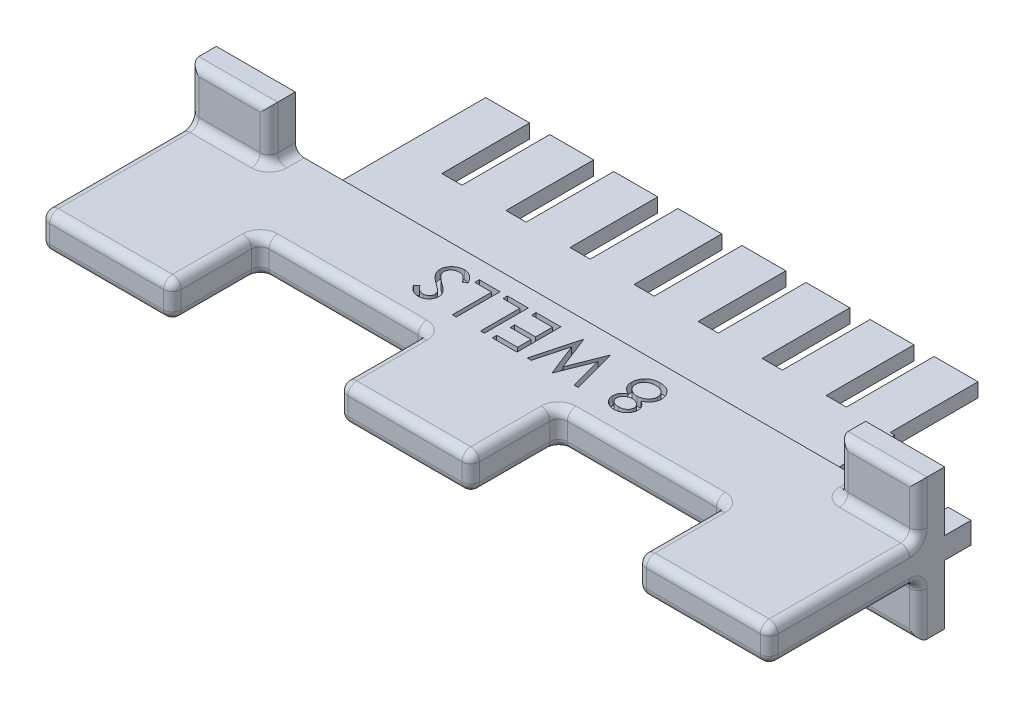
from build123d import *

# Parameters (mm, degrees)
SKETCH1_W           = 83
SKETCH1_H           = 4
BOSS_EXTRUDE1_DEPTH = 10
SKETCH2_W           = 15
SKETCH2_H           = 4
BOSS_EXTRUDE2_DEPTH = 10
SKETCH3_W           = 2.6
SKETCH3_H           = 2.45
BOSS_EXTRUDE3_DEPTH = 3
SKETCH4_W           = 56.6
SKETCH4_H           = 1.6
BOSS_EXTRUDE4_DEPTH = 7.5
SKETCH5_W           = 5
SKETCH5_H           = 1.6
BOSS_EXTRUDE5_DEPTH = 10
SKETCH6_W           = 9
SKETCH6_H           = 6
BOSS_EXTRUDE6_DEPTH = 3
FILLET1_R           = 1
CUT_EXTRUDE1_DEPTH  = 1


with BuildPart() as part:
    # Sketch1 → Boss-Extrude1 (new body)
    with BuildSketch(Plane.XY):
        Rectangle(SKETCH1_W, SKETCH1_H)
    extrude(amount=BOSS_EXTRUDE1_DEPTH)

    # Sketch2 → Boss-Extrude2 (add)
    with BuildSketch(Plane.XY.offset(10)):
        with Locations((-34, 0)):
            Rectangle(SKETCH2_W, SKETCH2_H)
        with Locations((34, 0)):
            Rectangle(SKETCH2_W, SKETCH2_H)
        Rectangle(SKETCH2_W, SKETCH2_H)
    extrude(amount=BOSS_EXTRUDE2_DEPTH)

    # Sketch3 → Boss-Extrude3 (add)
    with BuildSketch(Plane(origin=(0, 0, 0), x_dir=(-1, 0, 0), z_dir=(0, 0, -1))):
        with Locations((40.2, 0)):
            Rectangle(SKETCH3_W, SKETCH3_H)
        with Locations((-40.2, 0)):
            Rectangle(SKETCH3_W, SKETCH3_H)
    extrude(amount=BOSS_EXTRUDE3_DEPTH)

    # Sketch4 → Boss-Extrude4 (add)
    with BuildSketch(Plane(origin=(0, 0, 0), x_dir=(-1, 0, 0), z_dir=(0, 0, -1))):
        Rectangle(SKETCH4_W, SKETCH4_H)
    extrude(amount=BOSS_EXTRUDE4_DEPTH)

    # Sketch5 → Boss-Extrude5 (add)
    with BuildSketch(Plane(origin=(0, 0, -7.5), x_dir=(-1, 0, 0), z_dir=(0, 0, -1))):
        with Locations((25.8, 0)):
            Rectangle(SKETCH5_W, SKETCH5_H)
        with Locations((18.500007934, 0)):
            Rectangle(SKETCH5_W, SKETCH5_H)
        with Locations((11.200015868, 0)):
            Rectangle(SKETCH5_W, SKETCH5_H)
        with Locations((3.900023803, 0)):
            Rectangle(SKETCH5_W, SKETCH5_H)
        with Locations((-3.399968263, 0)):
            Rectangle(SKETCH5_W, SKETCH5_H)
        with Locations((-10.699960329, 0)):
            Rectangle(SKETCH5_W, SKETCH5_H)
        with Locations((-17.999952395, 0)):
            Rectangle(SKETCH5_W, SKETCH5_H)
        with Locations((-25.299944461, 0)):
            Rectangle(SKETCH5_W, SKETCH5_H)
    extrude(amount=BOSS_EXTRUDE5_DEPTH)

    # Sketch6 → Boss-Extrude6 (add)
    with BuildSketch(Plane(origin=(0, 0, 0), x_dir=(-1, 0, 0), z_dir=(0, 0, -1))):
        with Locations((37, -5)):
            Rectangle(SKETCH6_W, SKETCH6_H)
        with Locations((37, 5)):
            Rectangle(SKETCH6_W, SKETCH6_H)
        with Locations((-37, -5)):
            Rectangle(SKETCH6_W, SKETCH6_H)
        with Locations((-37, 5)):
            Rectangle(SKETCH6_W, SKETCH6_H)
    extrude(amount=-BOSS_EXTRUDE6_DEPTH)

    # Fillet1
    fillet1_edges = [part.edges().sort_by_distance(p)[0] for p in [
        (-41.5, -2, 11.5),
        (-32.5, -2, 1.5),
        (-37, -2, 3),
        (-32.5, -5, 3),
        (-37, -8, 3),
        (-41.5, -5, 3),
        (-26.5, 0, 20),
        (-34, -2, 20),
        (-41.5, 0, 20),
        (-34, 2, 20),
        (32.5, -2, 1.5),
        (41.5, -2, 11.5),
        (41.5, 2, 11.5),
        (32.5, 2, 1.5),
        (-32.5, 2, 1.5),
        (-41.5, 2, 11.5),
        (37, -8, 3),
        (32.5, -5, 3),
        (37, -2, 3),
        (41.5, -5, 3),
        (34, -2, 20),
        (26.5, 0, 20),
        (34, 2, 20),
        (41.5, 0, 20),
        (37, 2, 3),
        (32.5, 5, 3),
        (37, 8, 3),
        (41.5, 5, 3),
        (0, -2, 20),
        (-7.5, 0, 20),
        (0, 2, 20),
        (7.5, 0, 20),
        (-37, 8, 3),
        (-32.5, 5, 3),
        (-37, 2, 3),
        (-41.5, 5, 3),
        (26.5, 2, 15),
        (26.5, -2, 15),
        (26.5, 0, 10),
        (17, -2, 10),
        (17, 2, 10),
        (7.5, -2, 15),
        (7.5, 2, 15),
        (7.5, 0, 10),
        (-7.5, 2, 15),
        (-7.5, -2, 15),
        (-26.5, -2, 15),
        (-26.5, 2, 15),
        (-26.5, 0, 10),
        (-17, 2, 10),
        (-7.5, 0, 10),
        (-17, -2, 10),
    ]]
    fillet(fillet1_edges, radius=FILLET1_R)

    # Sketch8 → Cut-Extrude1 (cut)
    # profile 1 of 6: a face of its own
    with BuildSketch(Plane(origin=(0, 2, 0), x_dir=(1, 0, 0), z_dir=(0, 1, 0))):
        with BuildLine():
            add(Edge.make_bspline(
                [(10.261418269, -4.830480864), (10.220817543, -4.809144786), (10.141384874, -4.767402142), (10.028230031, -4.69998647), (9.922617945, -4.63139338), (9.826501979, -4.559156677), (9.738939811, -4.48481186), (9.659661979, -4.408555649), (9.5878159, -4.330629215), (9.525869801, -4.249029215), (9.470907682, -4.165206737), (9.424348025, -4.07812869), (9.383713268, -3.989053365), (9.351820047, -3.896628417), (9.325488539, -3.802121786), (9.307384504, -3.704265351), (9.297644979, -3.603716879), (9.295803964, -3.535762082), (9.294871795, -3.501354261)],
                knots=[0, 0, 0, 0, 1.264219729, 2.473363326, 3.62979159, 4.734286947, 5.785533755, 6.79450939, 7.765315851, 8.704182021, 9.615576613, 10.525715488, 11.423813905, 12.311666436, 13.218214638, 14.126256791, 15.051260205, 16, 16, 16, 16], degree=3))
            add(Edge.make_bspline(
                [(9.294871795, -3.501354261), (9.295967647, -3.453212569), (9.298136751, -3.357922096), (9.317226531, -3.217314953), (9.345424662, -3.080203895), (9.388260323, -2.948143234), (9.440971639, -2.820007788), (9.507486351, -2.697523887), (9.582556815, -2.577175581), (9.642929245, -2.503152652), (9.673477564, -2.46569721)],
                knots=[0, 0, 0, 0, 1.02531512, 2.029483338, 3.018748588, 4.004195107, 4.983200899, 5.966616707, 6.971112471, 8, 8, 8, 8], degree=3))
            add(Edge.make_bspline(
                [(9.673477564, -2.46569721), (9.713243956, -2.421991818), (9.792285335, -2.335121115), (9.927689518, -2.222334243), (10.076292209, -2.127549395), (10.237518398, -2.050303831), (10.410937115, -1.990181175), (10.596511407, -1.946977578), (10.794603054, -1.922231251), (10.930753727, -1.918654123), (11.000600962, -1.916819005)],
                knots=[0, 0, 0, 0, 0.954267603, 1.896743057, 2.838368354, 3.796610408, 4.779680527, 5.799409237, 6.871065594, 8, 8, 8, 8], degree=3))
            add(Edge.make_bspline(
                [(11.000600962, -1.916819005), (11.067761399, -1.91846982), (11.198448787, -1.921682139), (11.388695621, -1.943327642), (11.566250852, -1.981648457), (11.731956309, -2.033013758), (11.88420967, -2.101510608), (12.023287764, -2.185467751), (12.151229032, -2.28298971), (12.264019798, -2.39642346), (12.364127822, -2.517945612), (12.452142418, -2.64327754), (12.524886205, -2.772328026), (12.587585506, -2.903134075), (12.634245953, -3.038346099), (12.667340624, -3.176576511), (12.688128694, -3.317432615), (12.690908994, -3.412475114), (12.692307692, -3.460288556)],
                knots=[0, 0, 0, 0, 1.256864279, 2.445730223, 3.576845088, 4.651810441, 5.686528262, 6.692706664, 7.686234615, 8.689148594, 9.678739427, 10.630299996, 11.55097961, 12.448208961, 13.341360817, 14.221834469, 15.105450545, 16, 16, 16, 16], degree=3))
            add(Edge.make_bspline(
                [(12.692307692, -3.460288556), (12.691481946, -3.495373037), (12.689849979, -3.564712356), (12.678560262, -3.667155395), (12.660394486, -3.766859928), (12.635778189, -3.864219498), (12.602111102, -3.958720389), (12.562169928, -4.050849955), (12.515149581, -4.140605528), (12.459198526, -4.2266206), (12.39755497, -4.311942035), (12.324378397, -4.392333231), (12.24454745, -4.472516255), (12.153309764, -4.547615184), (12.055592846, -4.623834244), (11.94683941, -4.694802869), (11.830675736, -4.766059818), (11.748092628, -4.80863874), (11.705729167, -4.830480864)],
                knots=[0, 0, 0, 0, 0.941575622, 1.860885767, 2.762557628, 3.660168386, 4.552890429, 5.45184204, 6.353736508, 7.268493418, 8.204037487, 9.175167802, 10.182660057, 11.238220596, 12.344046335, 13.507168087, 14.721227736, 16, 16, 16, 16], degree=3))
            add(Edge.make_bspline(
                [(11.705729167, -4.830480864), (11.763646249, -4.862193809), (11.875614569, -4.923502927), (12.025289116, -5.034739717), (12.152076113, -5.157398979), (12.254628155, -5.2916653), (12.335598184, -5.433125812), (12.392844918, -5.581035802), (12.430211169, -5.73374558), (12.433996405, -5.83787849), (12.435897436, -5.890176377)],
                knots=[0, 0, 0, 0, 1.16701039, 2.256125286, 3.287752239, 4.277689688, 5.235169525, 6.160862735, 7.076343936, 8, 8, 8, 8], degree=3))
            add(Edge.make_bspline(
                [(12.435897436, -5.890176377), (12.433556971, -5.943456144), (12.42885223, -6.050557769), (12.390939866, -6.210032944), (12.328689763, -6.366748966), (12.245470643, -6.520342668), (12.139564028, -6.66381539), (12.014208748, -6.793535387), (11.869562489, -6.906145363), (11.708804528, -7.001337807), (11.536115572, -7.079184233), (11.35360603, -7.132328819), (11.16452867, -7.167282059), (11.035815236, -7.17122835), (10.970552885, -7.173229261)],
                knots=[0, 0, 0, 0, 0.888724595, 1.786491426, 2.720083884, 3.697804067, 4.69440576, 5.687697823, 6.7000873, 7.744853364, 8.800284131, 9.853047784, 10.91141782, 12, 12, 12, 12], degree=3))
            add(Edge.make_bspline(
                [(10.970552885, -7.173229261), (10.906973633, -7.171171984), (10.781602593, -7.167115268), (10.597044831, -7.132946984), (10.420306525, -7.076520153), (10.252378227, -6.999666605), (10.096833088, -6.903904835), (9.958412313, -6.790055598), (9.835985899, -6.661749053), (9.734839584, -6.517803128), (9.653698873, -6.364219668), (9.595268216, -6.204902917), (9.558327878, -6.041762837), (9.553633861, -5.931432127), (9.551282051, -5.876153941)],
                knots=[0, 0, 0, 0, 1.072634126, 2.115112298, 3.156050586, 4.19761425, 5.225177188, 6.230426315, 7.215180151, 8.209739481, 9.190420596, 10.139012357, 11.067603024, 12, 12, 12, 12], degree=3))
            add(Edge.make_bspline(
                [(9.551282051, -5.876153941), (9.553343821, -5.821906327), (9.55739302, -5.715367095), (9.591006984, -5.560281358), (9.648497298, -5.415341124), (9.726051913, -5.278316081), (9.827844113, -5.151395878), (9.951818618, -5.033950186), (10.096366716, -4.923682014), (10.205171279, -4.86224236), (10.261418269, -4.830480864)],
                knots=[0, 0, 0, 0, 0.975463758, 1.915755378, 2.838359076, 3.772025586, 4.738400888, 5.753889765, 6.838863581, 8, 8, 8, 8], degree=3))
        make_face()
        with BuildLine():
            add(Edge.make_bspline(
                [(10.995592949, -6.660408749), (11.030666754, -6.659481132), (11.099286454, -6.657666308), (11.199881673, -6.648111771), (11.295618254, -6.629759005), (11.387019721, -6.604615962), (11.474399182, -6.573332979), (11.555752868, -6.532116582), (11.633814728, -6.486304386), (11.706023871, -6.432568766), (11.77139148, -6.373942043), (11.829776279, -6.312715664), (11.87734177, -6.247084704), (11.918264106, -6.180332593), (11.948654656, -6.109690619), (11.970243055, -6.036705512), (11.985521333, -5.960914987), (11.986622473, -5.909283195), (11.987179487, -5.883165159)],
                knots=[0, 0, 0, 0, 1.20353747, 2.354645537, 3.462130888, 4.543058862, 5.604822423, 6.639552563, 7.666902586, 8.706944258, 9.720926464, 10.677177239, 11.602682187, 12.496457588, 13.358248655, 14.231532794, 15.105417644, 16, 16, 16, 16], degree=3))
            add(Edge.make_bspline(
                [(11.987179487, -5.883165159), (11.986163624, -5.857061911), (11.984156131, -5.805478144), (11.969625835, -5.72899801), (11.945331058, -5.654819648), (11.912017693, -5.582250585), (11.869266227, -5.511477091), (11.817378713, -5.442227966), (11.754103767, -5.376334447), (11.684229132, -5.31192701), (11.607903457, -5.252587485), (11.527699058, -5.199582173), (11.443030597, -5.157326806), (11.356433697, -5.120277484), (11.266077039, -5.092486196), (11.172583639, -5.072464211), (11.076053367, -5.060079364), (11.010653647, -5.058595447), (10.977564103, -5.057844646)],
                knots=[0, 0, 0, 0, 0.873213166, 1.72559466, 2.594724523, 3.479581045, 4.391597569, 5.35687048, 6.368548091, 7.443976143, 8.534559525, 9.600545123, 10.654815915, 11.696401765, 12.749428718, 13.812189468, 14.893058657, 16, 16, 16, 16], degree=3))
            add(Edge.make_bspline(
                [(10.977564103, -5.057844646), (10.93506141, -5.059085311), (10.85047582, -5.061554387), (10.725828689, -5.084720478), (10.604326533, -5.120699608), (10.488268382, -5.17176548), (10.379731404, -5.234027049), (10.281776788, -5.307450863), (10.198503754, -5.393761224), (10.127659594, -5.487951478), (10.07226949, -5.587864582), (10.029839803, -5.688540198), (10.004852462, -5.790807584), (10.001604313, -5.859334595), (10, -5.893181185)],
                knots=[0, 0, 0, 0, 1.076561449, 2.142489767, 3.202892658, 4.283174188, 5.348766409, 6.369549039, 7.375093932, 8.378927502, 9.349008457, 10.26378795, 11.142457041, 12, 12, 12, 12], degree=3))
            add(Edge.make_bspline(
                [(10, -5.893181185), (10.000745799, -5.916940503), (10.002226104, -5.964099345), (10.01491883, -6.033968273), (10.034715608, -6.102291267), (10.063572208, -6.16866724), (10.098479712, -6.234638165), (10.142975441, -6.298134474), (10.194543451, -6.361077743), (10.253928202, -6.421396161), (10.321020722, -6.478024711), (10.396363738, -6.527112793), (10.479292373, -6.568046793), (10.568694837, -6.602436411), (10.665515923, -6.627977869), (10.768922023, -6.647198743), (10.879846176, -6.658010014), (10.95617389, -6.659591829), (10.995592949, -6.660408749)],
                knots=[0, 0, 0, 0, 0.814035228, 1.61574325, 2.427118093, 3.24780647, 4.092880925, 4.981933388, 5.900917883, 6.880367106, 7.87994501, 8.905470125, 9.95492938, 11.0455354, 12.184050453, 13.382997595, 14.64846247, 16, 16, 16, 16], degree=3))
        make_face(mode=Mode.SUBTRACT)
        with BuildLine():
            add(Edge.make_bspline(
                [(10.966546474, -4.545024133), (11.01101176, -4.544232991), (11.098241802, -4.542680963), (11.22603914, -4.525413446), (11.348680234, -4.501359815), (11.4657886, -4.464929314), (11.576763103, -4.417528281), (11.683165506, -4.361318776), (11.783329578, -4.293946131), (11.876807618, -4.217044059), (11.962389274, -4.133707132), (12.037745118, -4.045692204), (12.101410122, -3.95419441), (12.153074987, -3.859098018), (12.193155221, -3.760612554), (12.222735053, -3.658680546), (12.239909065, -3.553017669), (12.24235601, -3.481382498), (12.243589744, -3.445264518)],
                knots=[0, 0, 0, 0, 1.140332253, 2.237053636, 3.304055028, 4.344690294, 5.377465719, 6.397042765, 7.428360044, 8.469453732, 9.499453352, 10.490108612, 11.438398528, 12.354680514, 13.261581007, 14.161901135, 15.073242693, 16, 16, 16, 16], degree=3))
            add(Edge.make_bspline(
                [(12.243589744, -3.445264518), (12.241606243, -3.400371068), (12.237656619, -3.310977491), (12.207446646, -3.179195487), (12.157833138, -3.051653911), (12.088231235, -2.930151539), (12.003333187, -2.816161533), (11.900123049, -2.715401577), (11.781117194, -2.629228053), (11.647293311, -2.557204666), (11.500596132, -2.500161167), (11.34193222, -2.459350436), (11.172376311, -2.433699167), (11.055449376, -2.431014059), (10.995592949, -2.429639518)],
                knots=[0, 0, 0, 0, 0.899105568, 1.790333855, 2.694925079, 3.632758987, 4.588257081, 5.534574046, 6.511571685, 7.523527334, 8.572244311, 9.657983075, 10.801090915, 12, 12, 12, 12], degree=3))
            add(Edge.make_bspline(
                [(10.995592949, -2.429639518), (10.948809952, -2.430548306), (10.857661673, -2.432318918), (10.72463683, -2.447622631), (10.599397239, -2.47262089), (10.480743066, -2.506515849), (10.36955748, -2.551446588), (10.265992032, -2.607254872), (10.168636442, -2.670999996), (10.081651501, -2.746468708), (10.002560804, -2.827224899), (9.933283588, -2.912263838), (9.874653758, -3.000733852), (9.827392483, -3.092583157), (9.789862517, -3.187474211), (9.762807684, -3.285796544), (9.746133027, -3.387936356), (9.744445262, -3.45722023), (9.743589744, -3.492339838)],
                knots=[0, 0, 0, 0, 1.224631902, 2.385975653, 3.500340538, 4.565441647, 5.612488581, 6.63322211, 7.641830068, 8.652595074, 9.641693811, 10.598750962, 11.520088299, 12.415429315, 13.298523938, 14.187139574, 15.081071174, 16, 16, 16, 16], degree=3))
            add(Edge.make_bspline(
                [(9.743589744, -3.492339838), (9.744875263, -3.526454209), (9.747410084, -3.593721789), (9.763729353, -3.693331924), (9.791744142, -3.789962193), (9.832594428, -3.883176772), (9.882760653, -3.974059986), (9.944731949, -4.061848859), (10.01775301, -4.146786473), (10.101645104, -4.227124056), (10.192565187, -4.301392505), (10.288920625, -4.367393256), (10.391150538, -4.421336275), (10.497229793, -4.466652209), (10.608227762, -4.501967206), (10.723609066, -4.526730545), (10.843592288, -4.542294287), (10.925098719, -4.544103904), (10.966546474, -4.545024133)],
                knots=[0, 0, 0, 0, 0.917336384, 1.808827106, 2.706624561, 3.615530867, 4.539869921, 5.493819324, 6.499753197, 7.547410123, 8.613069608, 9.653934021, 10.682176708, 11.716048074, 12.752411263, 13.808993382, 14.885826486, 16, 16, 16, 16], degree=3))
        make_face(mode=Mode.SUBTRACT)
    # profile 2 of 6: a face of its own
    with BuildSketch(Plane(origin=(0, 2, 0), x_dir=(1, 0, 0), z_dir=(0, 1, 0))):
        Polygon((6.794871795, -7.045024133), (6.331129808, -7.045024133), (5.352564103, -3.378157146), (3.897235577, -7.045024133), (3.83213141, -7.045024133), (2.403846154, -3.40319721), (1.420272436, -7.045024133), (0.961538462, -7.045024133), (2.309695513, -2.045024133), (2.373798077, -2.045024133), (3.878205128, -5.869142723), (5.400641026, -2.045024133), (5.46474359, -2.045024133), align=None)
    # profile 3 of 6: a face of its own
    with BuildSketch(Plane(origin=(0, 2, 0), x_dir=(1, 0, 0), z_dir=(0, 1, 0))):
        Polygon((-0.192307692, -7.045024133), (-3.012820513, -7.045024133), (-3.012820513, -6.53220362), (-0.641025641, -6.53220362), (-0.641025641, -4.993742082), (-3.012820513, -4.993742082), (-3.012820513, -4.480921569), (-0.641025641, -4.480921569), (-0.641025641, -2.557844646), (-3.012820513, -2.557844646), (-3.012820513, -2.045024133), (-0.192307692, -2.045024133), align=None)
    # profile 4 of 6: a face of its own
    with BuildSketch(Plane(origin=(0, 2, 0), x_dir=(1, 0, 0), z_dir=(0, 1, 0))):
        Polygon((-3.91025641, -7.045024133), (-4.358974359, -7.045024133), (-4.358974359, -2.557844646), (-6.282051282, -2.557844646), (-6.282051282, -2.045024133), (-3.91025641, -2.045024133), align=None)
    # profile 5 of 6: a face of its own
    with BuildSketch(Plane(origin=(0, 2, 0), x_dir=(1, 0, 0), z_dir=(0, 1, 0))):
        Polygon((-7.115384615, -7.045024133), (-7.564102564, -7.045024133), (-7.564102564, -2.557844646), (-9.487179487, -2.557844646), (-9.487179487, -2.045024133), (-7.115384615, -2.045024133), align=None)
    # profile 6 of 6: a face of its own
    with BuildSketch(Plane(origin=(0, 2, 0), x_dir=(1, 0, 0), z_dir=(0, 1, 0))):
        with BuildLine():
            Line((-9.807692308, -3.009567402), (-10.23036859, -3.262972851))
            add(Edge.make_bspline(
                [(-10.23036859, -3.262972851), (-10.269680357, -3.197166587), (-10.345000187, -3.071084324), (-10.470644986, -2.900715695), (-10.600834859, -2.755912614), (-10.736533907, -2.63751746), (-10.876913832, -2.544304765), (-11.022891052, -2.478301577), (-11.173973639, -2.437135898), (-11.276793384, -2.432135774), (-11.328125, -2.429639518)],
                knots=[0, 0, 0, 0, 1.272034388, 2.437168799, 3.508375237, 4.49857839, 5.41946034, 6.295179144, 7.148887113, 8, 8, 8, 8], degree=3))
            add(Edge.make_bspline(
                [(-11.328125, -2.429639518), (-11.371954502, -2.430889524), (-11.458846592, -2.433367665), (-11.587016381, -2.456217403), (-11.710872361, -2.493599407), (-11.829181822, -2.544275191), (-11.938815817, -2.606565217), (-12.036480966, -2.680022202), (-12.119001238, -2.764880154), (-12.187223121, -2.858079446), (-12.240628341, -2.957674629), (-12.278627427, -3.061212939), (-12.303037216, -3.168034604), (-12.306132027, -3.240474158), (-12.307692308, -3.276995287)],
                knots=[0, 0, 0, 0, 1.095645842, 2.172120455, 3.244862764, 4.326153987, 5.384857088, 6.392105572, 7.372507978, 8.334705661, 9.272564127, 10.189475455, 11.087205874, 12, 12, 12, 12], degree=3))
            add(Edge.make_bspline(
                [(-12.307692308, -3.276995287), (-12.305631385, -3.318638967), (-12.301457793, -3.40297196), (-12.264675644, -3.52760827), (-12.208510842, -3.65148293), (-12.15572224, -3.72812182), (-12.128405449, -3.767780543)],
                knots=[0, 0, 0, 0, 0.938992559, 1.901562324, 2.914110574, 4, 4, 4, 4], degree=3))
            add(Edge.make_bspline(
                [(-12.128405449, -3.767780543), (-12.106085523, -3.796481036), (-12.059090087, -3.856910995), (-11.977108275, -3.94528344), (-11.883889791, -4.03885355), (-11.777021172, -4.13575368), (-11.658060793, -4.237965999), (-11.525659978, -4.343594856), (-11.381364713, -4.454215663), (-11.27958906, -4.527277526), (-11.226963141, -4.565056185)],
                knots=[0, 0, 0, 0, 0.722283655, 1.520795216, 2.39349503, 3.346893347, 4.386874146, 5.510198126, 6.712579003, 8, 8, 8, 8], degree=3))
            add(Edge.make_bspline(
                [(-11.226963141, -4.565056185), (-11.174364449, -4.602534172), (-11.073799756, -4.674189229), (-10.933053922, -4.780398761), (-10.807364907, -4.878123265), (-10.696092265, -4.966001475), (-10.60211476, -5.047866194), (-10.521996835, -5.119329929), (-10.458694345, -5.184208764), (-10.423468003, -5.226263007), (-10.407652244, -5.245144326)],
                knots=[0, 0, 0, 0, 1.452255772, 2.776602448, 3.96446981, 5.032613149, 5.964194703, 6.766668629, 7.446264616, 8, 8, 8, 8], degree=3))
            add(Edge.make_bspline(
                [(-10.407652244, -5.245144326), (-10.385552312, -5.274575839), (-10.342089832, -5.332456861), (-10.284657031, -5.422900125), (-10.236223793, -5.51530739), (-10.197244092, -5.610013561), (-10.165722685, -5.706306865), (-10.143807221, -5.804910234), (-10.130298992, -5.905154288), (-10.12890363, -5.972599812), (-10.128205128, -6.006362274)],
                knots=[0, 0, 0, 0, 1.068019517, 2.100403715, 3.106014851, 4.09224787, 5.069873182, 6.043214339, 7.020455327, 8, 8, 8, 8], degree=3))
            add(Edge.make_bspline(
                [(-10.128205128, -6.006362274), (-10.130061496, -6.059266485), (-10.133734553, -6.163944115), (-10.165054501, -6.316779541), (-10.213905187, -6.463148887), (-10.284580931, -6.599794501), (-10.371878698, -6.726522677), (-10.475501314, -6.841085368), (-10.597389337, -6.939539184), (-10.733081834, -7.023232798), (-10.879873148, -7.090001634), (-11.034142211, -7.138653592), (-11.195195819, -7.167166609), (-11.304642448, -7.171188521), (-11.360176282, -7.173229261)],
                knots=[0, 0, 0, 0, 1.005367131, 1.989245246, 2.955191616, 3.932180104, 4.904534562, 5.875498653, 6.859376768, 7.874484044, 8.900379497, 9.918679785, 10.943926428, 12, 12, 12, 12], degree=3))
            add(Edge.make_bspline(
                [(-11.360176282, -7.173229261), (-11.419114634, -7.171262547), (-11.535996434, -7.167362316), (-11.707974325, -7.131365167), (-11.874542669, -7.075434995), (-12.008034124, -7.008823238), (-12.112549287, -6.943010929), (-12.192169521, -6.882914417), (-12.273293038, -6.813878112), (-12.355045765, -6.734439505), (-12.438235438, -6.646189546), (-12.522478669, -6.548380569), (-12.608563888, -6.441894176), (-12.663926291, -6.365855922), (-12.692307692, -6.326875095)],
                knots=[0, 0, 0, 0, 1.286534051, 2.551350862, 3.822568981, 5.117864672, 5.799956111, 6.519305446, 7.295594771, 8.126302591, 9.008831062, 9.944975596, 10.946496709, 12, 12, 12, 12], degree=3))
            Line((-12.692307692, -6.326875095), (-12.286658654, -6.019383108))
            add(Edge.make_bspline(
                [(-12.286658654, -6.019383108), (-12.262166251, -6.050940207), (-12.214999609, -6.111711801), (-12.143362298, -6.196789377), (-12.075944738, -6.274609563), (-12.009013791, -6.342024516), (-11.947728709, -6.404083282), (-11.887190861, -6.45627091), (-11.829738911, -6.500244196), (-11.757486688, -6.547233413), (-11.66572616, -6.592695827), (-11.551613284, -6.631782667), (-11.432283383, -6.655803848), (-11.351272947, -6.658856909), (-11.310096154, -6.660408749)],
                knots=[0, 0, 0, 0, 1.181426797, 2.275151783, 3.28963443, 4.225459815, 5.084396437, 5.868484344, 6.587427557, 7.222918358, 8.415355282, 9.605213164, 10.782753814, 12, 12, 12, 12], degree=3))
            add(Edge.make_bspline(
                [(-11.310096154, -6.660408749), (-11.25843179, -6.658706093), (-11.158801931, -6.655422682), (-11.017686229, -6.618619291), (-10.889941304, -6.562662214), (-10.780443797, -6.481972694), (-10.690033403, -6.385775243), (-10.623822408, -6.276068826), (-10.584236018, -6.154902356), (-10.579390713, -6.07042095), (-10.576923077, -6.027395928)],
                knots=[0, 0, 0, 0, 1.144248881, 2.206576175, 3.214949548, 4.222996039, 5.203671638, 6.127710127, 7.046472867, 8, 8, 8, 8], degree=3))
            add(Edge.make_bspline(
                [(-10.576923077, -6.027395928), (-10.577543308, -6.000621284), (-10.578792412, -5.946699014), (-10.593684755, -5.867196304), (-10.615908455, -5.788629526), (-10.647409936, -5.710546018), (-10.690220821, -5.630721251), (-10.748365519, -5.549610209), (-10.821125909, -5.465182894), (-10.876967593, -5.410325386), (-10.906450321, -5.381362274)],
                knots=[0, 0, 0, 0, 0.858500039, 1.728959331, 2.587258638, 3.476905708, 4.426389682, 5.487945037, 6.673710648, 8, 8, 8, 8], degree=3))
            add(Edge.make_bspline(
                [(-10.906450321, -5.381362274), (-10.917395138, -5.371595095), (-10.94339752, -5.348390511), (-10.990934557, -5.310401539), (-11.053709983, -5.263540436), (-11.130084556, -5.205558555), (-11.221466501, -5.138299323), (-11.327865867, -5.062622734), (-11.448096628, -4.976072079), (-11.533413651, -4.915561306), (-11.578525641, -4.8835658)],
                knots=[0, 0, 0, 0, 0.420754252, 0.999615792, 1.744751191, 2.668019286, 3.750313428, 4.999500688, 6.413464383, 8, 8, 8, 8], degree=3))
            add(Edge.make_bspline(
                [(-11.578525641, -4.8835658), (-11.632791193, -4.844078115), (-11.737868914, -4.767615687), (-11.88738026, -4.652736522), (-12.02294107, -4.540381275), (-12.145037317, -4.431274748), (-12.254841634, -4.32622016), (-12.351247129, -4.224035058), (-12.434691218, -4.125389559), (-12.525751578, -3.99977991), (-12.617695548, -3.844082152), (-12.696529945, -3.653237045), (-12.746683039, -3.461844272), (-12.753196542, -3.333371554), (-12.756410256, -3.269984069)],
                knots=[0, 0, 0, 0, 1.163604038, 2.253157948, 3.268574773, 4.215621239, 5.091738613, 5.902582348, 6.650434646, 7.330118262, 8.591011492, 9.77460283, 10.902005569, 12, 12, 12, 12], degree=3))
            add(Edge.make_bspline(
                [(-12.756410256, -3.269984069), (-12.755470009, -3.225158662), (-12.753607773, -3.136378326), (-12.732256542, -3.006001884), (-12.700862764, -2.879431158), (-12.654074114, -2.758241266), (-12.595586942, -2.641081534), (-12.524379279, -2.528157389), (-12.438083699, -2.421324295), (-12.342219663, -2.318507524), (-12.235738973, -2.225519919), (-12.123060663, -2.142697321), (-12.004817169, -2.071782763), (-11.879658172, -2.016070712), (-11.749645381, -1.971505835), (-11.614168507, -1.939562904), (-11.472936436, -1.919891418), (-11.37693436, -1.917854576), (-11.328125, -1.916819005)],
                knots=[0, 0, 0, 0, 0.98378539, 1.948466333, 2.894822735, 3.844243623, 4.795447569, 5.768042124, 6.770299647, 7.807997672, 8.852593179, 9.870666288, 10.876941106, 11.874841786, 12.874492863, 13.892063892, 14.928283473, 16, 16, 16, 16], degree=3))
            add(Edge.make_bspline(
                [(-11.328125, -1.916819005), (-11.290361891, -1.917557632), (-11.215311261, -1.919025584), (-11.104600263, -1.931695771), (-10.995922262, -1.95027676), (-10.890641808, -1.978606014), (-10.787448091, -2.013786535), (-10.687260491, -2.056859669), (-10.589837326, -2.108137258), (-10.495058251, -2.167698619), (-10.40205577, -2.236358883), (-10.311205228, -2.315634394), (-10.222051831, -2.40514569), (-10.134225246, -2.504768208), (-10.04979434, -2.616148638), (-9.966635927, -2.737520615), (-9.885183017, -2.869276248), (-9.834004999, -2.961930236), (-9.807692308, -3.009567402)],
                knots=[0, 0, 0, 0, 0.915366252, 1.81920441, 2.69897508, 3.586533125, 4.459536084, 5.340758185, 6.227946952, 7.126403341, 8.052553006, 9.028121456, 10.047063623, 11.114014537, 12.24582441, 13.433687931, 14.680555077, 16, 16, 16, 16], degree=3))
        make_face()
    extrude(amount=-CUT_EXTRUDE1_DEPTH, mode=Mode.SUBTRACT)


solid = part.part
